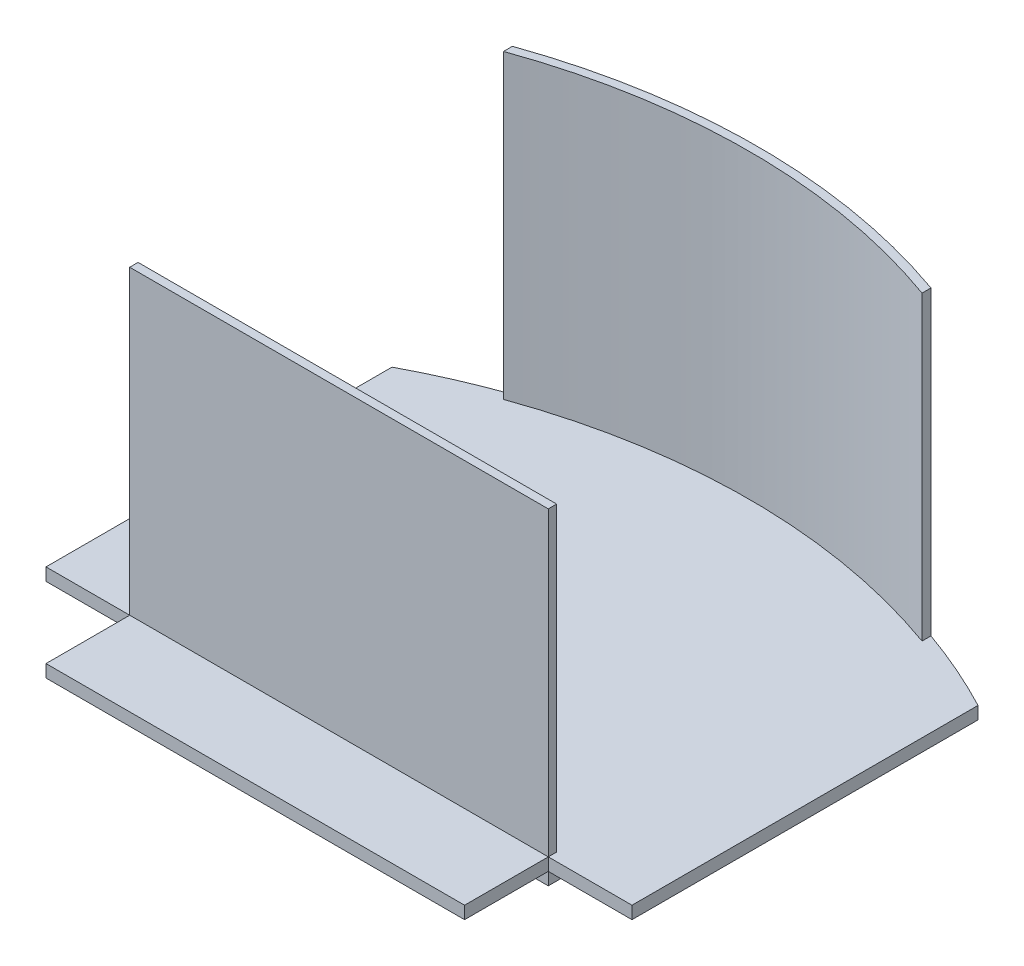
from build123d import *

# Parameters (mm, degrees)
SKETCH1_W           = 100
SKETCH1_H           = 20
BOSS_EXTRUDE1_DEPTH = 6
SKETCH2_W           = 100
SKETCH2_H           = 20
CUT_EXTRUDE3_DEPTH  = 3
BOSS_EXTRUDE2_DEPTH = 72
SHELL1_START        = 2
SHELL1_DEPTH        = 74
SHELL1_START_2      = 5
SHELL1_2_DEPTH      = 71
CUT_EXTRUDE4_START  = -72
CUT_EXTRUDE4_DEPTH  = 72
BOSS_EXTRUDE3_DEPTH = 6


# Read off the part's stored shape, not the designer's step: Shell1
with BuildPart() as part:
    # Sketch1 → Boss-Extrude1 (new body)
    with BuildSketch(Plane(origin=(0, 0, 0), x_dir=(1, 0, 0), z_dir=(0, 1, 0))):
        with BuildLine():
            Line((-50, 141.421356237), (-50, 50))
            Line((-50, 50), (50, 50))
            Line((50, 50), (50, 141.421356237))
            ThreePointArc((50, 141.421356237), (0, 150), (-50, 141.421356237))
        make_face()
        with BuildLine():
            Line((-70, 50), (-50, 50))
            Line((-50, 50), (-50, 141.421356237))
            ThreePointArc((-50, 141.421356237), (-60.159525267, 137.407538074), (-70, 132.664991614))
            Line((-70, 132.664991614), (-70, 50))
        make_face()
        with Locations((0, 40)):
            Rectangle(SKETCH1_W, SKETCH1_H)
        with BuildLine():
            Line((50, 141.421356237), (50, 50))
            Line((50, 50), (70, 50))
            Line((70, 50), (70, 132.664991614))
            ThreePointArc((70, 132.664991614), (60.159525267, 137.407538074), (50, 141.421356237))
        make_face()
    extrude(amount=BOSS_EXTRUDE1_DEPTH)

    # Sketch2 → Cut-Extrude3 (cut)
    with BuildSketch(Plane.XZ):
        with BuildLine():
            ThreePointArc((-70, -132.664991614), (-60.159525267, -137.407538074), (-50, -141.421356237))
            Line((-50, -141.421356237), (-50, -50))
            Line((-50, -50), (-70, -50))
            Line((-70, -50), (-70, -132.664991614))
        make_face()
        with Locations((0, -40)):
            Rectangle(SKETCH2_W, SKETCH2_H)
        with BuildLine():
            Line((50, -50), (50, -141.421356237))
            ThreePointArc((50, -141.421356237), (60.159525267, -137.407538074), (70, -132.664991614))
            Line((70, -132.664991614), (70, -50))
            Line((70, -50), (50, -50))
        make_face()
    extrude(amount=-CUT_EXTRUDE3_DEPTH, mode=Mode.SUBTRACT)

    # Sketch3 → Boss-Extrude2 (add)
    with BuildSketch(Plane(origin=(0, 6, 0), x_dir=(-1, 0, 0), z_dir=(0, 1, 0))):
        with BuildLine():
            Line((50, -50), (-50, -50))
            Line((-50, -50), (-50, -141.421356237))
            ThreePointArc((-50, -141.421356237), (0, -150), (50, -141.421356237))
            Line((50, -141.421356237), (50, -50))
        make_face()
    extrude(amount=BOSS_EXTRUDE2_DEPTH)

    # Shell1 outline → Shell1 (cut)
    with BuildSketch(Plane(origin=(0, 0, 0), x_dir=(1, 0, 0), z_dir=(0, 1, 0)).offset(SHELL1_START)):
        with BuildLine():
            Line((48, 52), (48, 140))
            ThreePointArc((48, 140), (0, 148), (-48, 140))
            Line((-48, 140), (-48, 52))
            Line((-48, 52), (48, 52))
        make_face()
    extrude(amount=SHELL1_DEPTH, mode=Mode.SUBTRACT)

    # Shell1 2 outline → Shell1 2 (cut)
    with BuildSketch(Plane(origin=(0, 0, 0), x_dir=(1, 0, 0), z_dir=(0, 1, 0)).offset(SHELL1_START_2)):
        with BuildLine():
            Line((50, 52), (50, 139.298241195))
            ThreePointArc((50, 139.298241195), (49.001256273, 139.652700954), (48, 140))
            Line((48, 140), (48, 52))
            Line((48, 52), (50, 52))
        make_face()
    extrude(amount=SHELL1_2_DEPTH, mode=Mode.SUBTRACT)

    # Sketch4 → Cut-Extrude4 (cut)
    with BuildSketch(Plane(origin=(0, 78, 0), x_dir=(-1, 0, 0), z_dir=(0, 1, 0)).offset(CUT_EXTRUDE4_START)):
        with BuildLine():
            Line((50, -52), (-50, -52))
            Line((-50, -52), (-50, -139.298241195))
            ThreePointArc((-50, -139.298241195), (0, -148), (50, -139.298241195))
            Line((50, -139.298241195), (50, -52))
        make_face()
    extrude(amount=CUT_EXTRUDE4_DEPTH, mode=Mode.SUBTRACT)

    # Sketch5 → Boss-Extrude3 (add)
    with BuildSketch(Plane.XZ):
        with BuildLine():
            Line((-50, -141.421356237), (-50, -50))
            Line((-50, -50), (50, -50))
            Line((50, -50), (50, -141.421356237))
            ThreePointArc((50, -141.421356237), (0, -150), (-50, -141.421356237))
        make_face()
    extrude(amount=-BOSS_EXTRUDE3_DEPTH)


solid = part.part
